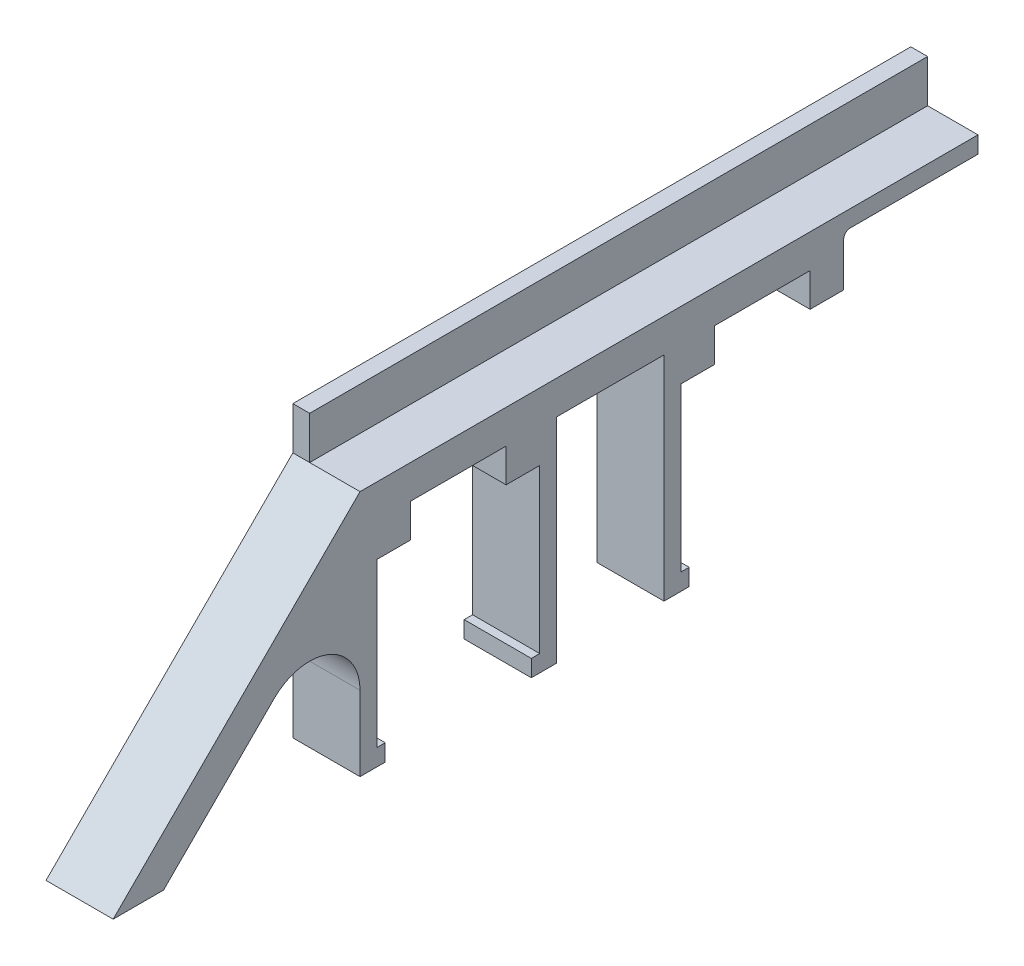
from build123d import *

# Parameters (mm, degrees)
BOSS_EXTRUDE2_DEPTH = 20
FILLET1_R           = 15
FILLET2_R           = 2
BOSS_EXTRUDE3_DEPTH = 12.7


with BuildPart() as part:
    # Sketch1 → Boss-Extrude2 (new body)
    with BuildSketch(Plane(origin=(0, 0, 0), x_dir=(0, 0, -1), z_dir=(1, 0, 0))):
        Polygon((-5, 68.5), (-78.5, -5), (-63.5, -5), (-5, 53.5), (-5, -5), (2.5, -5), (2.5, 0), (0, 0), (0, 48.5), (10, 48.5), (10, 58.5), (38.5, 58.5), (38.5, 48.5), (48.5, 48.5), (48.5, 0), (46, 0), (46, -5), (53.5, -5), (53.5, 58.5), (85.5, 58.5), (85.5, -5), (93, -5), (93, 0), (90.5, 0), (90.5, 48.5), (100.5, 48.5), (100.5, 58.5), (129, 58.5), (129, 48.5), (139, 48.5), (139, 63.5), (179, 63.5), (179, 68.5), align=None)
    extrude(amount=BOSS_EXTRUDE2_DEPTH)

    # Fillet1
    fillet1_edges = [part.edges().sort_by_distance(p)[0] for p in [
        (10, 53.5, 5),
    ]]
    fillet(fillet1_edges, radius=FILLET1_R)

    # Fillet2
    fillet2_edges = [part.edges().sort_by_distance(p)[0] for p in [
        (10, 63.5, -139),
    ]]
    fillet(fillet2_edges, radius=FILLET2_R)

    # Sketch2 → Boss-Extrude3 (add)
    with BuildSketch(Plane(origin=(0, 68.5, 0), x_dir=(1, 0, 0), z_dir=(0, 1, 0))):
        Polygon((5, 35), (5, 179), (0, 179), (0, -5), (5, -5), align=None)
    extrude(amount=BOSS_EXTRUDE3_DEPTH)


solid = part.part
